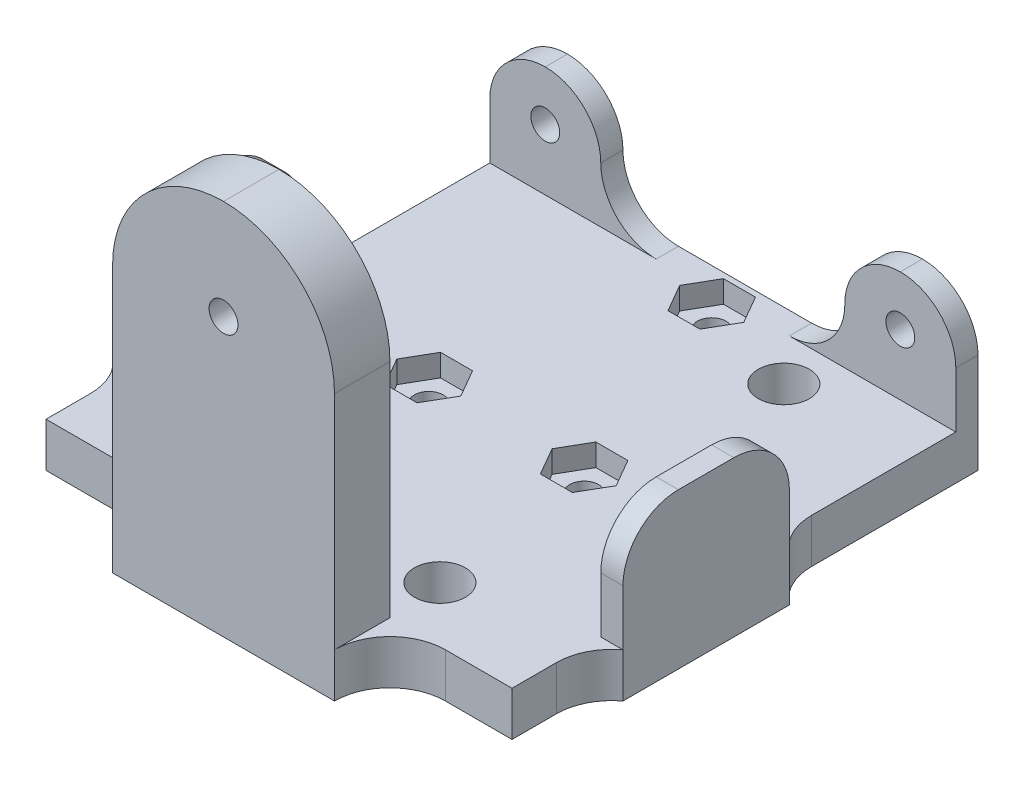
from build123d import *

# Parameters (mm, degrees)
EXTRUDE_1_DEPTH          = 4
SKETCH_2_W               = 2
SKETCH_2_H               = 15
SKETCH_2_W_2             = 10
SKETCH_2_H_2             = 2
EXTRUDE_2_DEPTH          = 10
SKETCH_3_W               = 20
SKETCH_3_H               = 5
EXTRUDE_3_DEPTH          = 30
SKETCH_4_R               = 1.3
CUT_EXTRUDE_1_DEPTH      = 2
SKETCH_5_R               = 1.3
CUT_EXTRUDE_2_DEPTH      = 59.72818744
CUT_EXTRUDE_3_DEPTH      = 3
SKETCH_7_R               = 1.3
SKETCH_7_R_2             = 2.3
CUT_EXTRUDE_5_DEPTH      = 45.511234537
CUT_EXTRUDE_6_DEPTH      = 2
CUT_EXTRUDE_6_DEPTH_BACK = 2
FILLET_1_R               = 10
FILLET_2_DEPTH           = 4
FILLET_START             = -23.5
FILLET_2_2_DEPTH         = 2
FILLET_START_2           = -24
FILLET_2_3_DEPTH         = 48
FILLET_2_4_DEPTH         = 2
FILLET_3_R               = 5


with BuildPart() as part:
    # 草图1 → 凸台-拉伸1 (new body)
    with BuildSketch(Plane(origin=(0, 0, 0), x_dir=(1, 0, 0), z_dir=(0, 1, 0))):
        Polygon((-21, 23.5), (-21, 4.5), (-23, 4.5), (-23, -10.5), (-21, -10.5), (-21, -18.5), (-11, -18.5), (-10, -18.5), (-10, -23.5), (10, -23.5), (10, -18.5), (11, -18.5), (21, -18.5), (21, -10.5), (23, -10.5), (23, 4.5), (21, 4.5), (21, 23.5), align=None)
    extrude(amount=EXTRUDE_1_DEPTH)

    # 草图2 → 凸台-拉伸2 (add)
    with BuildSketch(Plane(origin=(0, 4, 0), x_dir=(1, 0, 0), z_dir=(0, 1, 0))):
        with Locations((-22, -3)):
            Rectangle(SKETCH_2_W, SKETCH_2_H)
        with Locations((-16, 22.5)):
            Rectangle(SKETCH_2_W_2, SKETCH_2_H_2)
        with Locations((16, 22.5)):
            Rectangle(SKETCH_2_W_2, SKETCH_2_H_2)
        with Locations((22, -3)):
            Rectangle(SKETCH_2_W, SKETCH_2_H)
    extrude(amount=EXTRUDE_2_DEPTH)

    # 草图3 → 凸台-拉伸3 (add)
    with BuildSketch(Plane(origin=(0, 4, 0), x_dir=(1, 0, 0), z_dir=(0, 1, 0))):
        with Locations((0, -21)):
            Rectangle(SKETCH_3_W, SKETCH_3_H)
    extrude(amount=EXTRUDE_3_DEPTH)

    # 草图4 → 切除-拉伸1 (cut)
    with BuildSketch(Plane(origin=(0, 0, -23.5), x_dir=(-1, 0, 0), z_dir=(0, 0, -1))):
        with Locations((-16, 9.5)):
            Circle(SKETCH_4_R)
        with Locations((16, 9.5)):
            Circle(SKETCH_4_R)
    extrude(amount=-CUT_EXTRUDE_1_DEPTH, mode=Mode.SUBTRACT)

    # 草图5 → 切除-拉伸2 (cut, through all)
    with BuildSketch(Plane(origin=(0, 0, 18.5), x_dir=(-1, 0, 0), z_dir=(0, 0, -1))):
        with Locations((0, 25)):
            Circle(SKETCH_5_R)
    extrude(amount=-CUT_EXTRUDE_2_DEPTH, mode=Mode.SUBTRACT)

    # 草图6 → 切除-拉伸3 (cut)
    with BuildSketch(Plane(origin=(0, 0, 18.5), x_dir=(-1, 0, 0), z_dir=(0, 0, -1))):
        Polygon((2.886751346, 25), (1.443375673, 27.5), (-1.443375673, 27.5), (-2.886751346, 25), (-1.443375673, 22.5), (1.443375673, 22.5), align=None)
    extrude(amount=-CUT_EXTRUDE_3_DEPTH, mode=Mode.SUBTRACT)

    # 草图7 → 切除-拉伸5 (cut, through all)
    with BuildSketch(Plane(origin=(0, 4, 0), x_dir=(1, 0, 0), z_dir=(0, 1, 0))):
        with Locations(Location((0, 20.5, 0), (0, 0, 270))):
            Circle(SKETCH_7_R)
        with Locations(Location((-7, 2, 0), (0, 0, 270))):
            Circle(SKETCH_7_R)
        with Locations(Location((7, 2, 0), (0, 0, 270))):
            Circle(SKETCH_7_R)
        with Locations(Location((0, -16.5, 0), (0, 0, 270))):
            Circle(SKETCH_7_R)
        with Locations(Location((-18.5, 2, 0), (0, 0, 270))):
            Circle(SKETCH_7_R_2)
        with Locations(Location((9.5, 17.5, 0), (0, 0, 270))):
            Circle(SKETCH_7_R_2)
        with Locations(Location((9.5, -13.5, 0), (0, 0, 270))):
            Circle(SKETCH_7_R_2)
    extrude(amount=-CUT_EXTRUDE_5_DEPTH, mode=Mode.SUBTRACT)

    # 草图8 → 切除-拉伸6 (cut, two sides: drawn at the far end of the back side and taken through both)
    with BuildSketch(Plane(origin=(0, 4, 0), x_dir=(1, 0, 0), z_dir=(0, 1, 0)).offset(-CUT_EXTRUDE_6_DEPTH_BACK)):
        Polygon((9.886751346, 2), (8.443375673, 4.5), (5.556624327, 4.5), (4.113248654, 2), (5.556624327, -0.5), (8.443375673, -0.5), align=None)
        Polygon((-4.113248654, 2), (-5.556624327, 4.5), (-8.443375673, 4.5), (-9.886751346, 2), (-8.443375673, -0.5), (-5.556624327, -0.5), align=None)
        Polygon((2.886751346, 20.5), (1.443375673, 23), (-1.443375673, 23), (-2.886751346, 20.5), (-1.443375673, 18), (1.443375673, 18), align=None)
        Polygon((2.886751346, -16.5), (1.443375673, -14), (-1.443375673, -14), (-2.886751346, -16.5), (-1.443375673, -19), (1.443375673, -19), align=None)
    extrude(amount=CUT_EXTRUDE_6_DEPTH + CUT_EXTRUDE_6_DEPTH_BACK, mode=Mode.SUBTRACT)

    # 圆角1
    fillet_1_edges = [part.edges().sort_by_distance(p)[0] for p in [
        (-10, 34, 21),
        (10, 34, 21),
    ]]
    fillet(fillet_1_edges, radius=FILLET_1_R - 0.0001)  # a hair under: the kernel refuses the full size

    # 圆角2: read off the stored shape, not the designer's step
    # 圆角2 outline → 圆角2 (add)
    with BuildSketch(Plane(origin=(0, 0, 0), x_dir=(1, 0, 0), z_dir=(0, 1, 0))):
        with BuildLine():
            Line((-21, 4.5), (-21, 8.5))
            ThreePointArc((-21, 8.5), (-21.527864045, 6.263932023), (-23, 4.5))
            Line((-23, 4.5), (-21, 4.5))
        make_face()
        with BuildLine():
            ThreePointArc((21, -14.5), (21.527864045, -12.263932023), (23, -10.5))
            Line((23, -10.5), (21, -10.5))
            Line((21, -10.5), (21, -14.5))
        make_face()
        with BuildLine():
            Line((21, 4.5), (23, 4.5))
            ThreePointArc((23, 4.5), (21.527864045, 6.263932023), (21, 8.5))
            Line((21, 8.5), (21, 4.5))
        make_face()
        with BuildLine():
            Line((-21, -10.5), (-23, -10.5))
            ThreePointArc((-23, -10.5), (-21.527864045, -12.263932023), (-21, -14.5))
            Line((-21, -14.5), (-21, -10.5))
        make_face()
    extrude(amount=FILLET_2_DEPTH)

    # Fillet 2 2 outline → Fillet 2 2 (add)
    with BuildSketch(Plane.XY.offset(FILLET_START)):
        with BuildLine():
            Line((11, 4), (11, 9))
            ThreePointArc((11, 9), (9.535533906, 5.464466094), (6, 4))
            Line((6, 4), (11, 4))
        make_face()
        with BuildLine():
            Line((-11, 4), (-6, 4))
            ThreePointArc((-6, 4), (-9.535533906, 5.464466094), (-11, 9))
            Line((-11, 9), (-11, 4))
        make_face()
    extrude(amount=FILLET_2_2_DEPTH)

    # Fillet 2 3 outline → Fillet 2 3 (cut)
    with BuildSketch(Plane.YZ.offset(FILLET_START_2)):
        with BuildLine():
            Line((14, 10.5), (9, 10.5))
            ThreePointArc((9, 10.5), (12.535533906, 9.035533906), (14, 5.5))
            Line((14, 5.5), (14, 10.5))
        make_face()
        with BuildLine():
            Line((14, -4.5), (14, 0.5))
            ThreePointArc((14, 0.5), (12.535533906, -3.035533906), (9, -4.5))
            Line((9, -4.5), (14, -4.5))
        make_face()
    extrude(amount=FILLET_2_3_DEPTH, mode=Mode.SUBTRACT)

    # Fillet 2 4 outline → Fillet 2 4 (cut)
    with BuildSketch(Plane.XY.offset(FILLET_START)):
        with BuildLine():
            ThreePointArc((16, 14), (19.535533906, 12.535533906), (21, 9))
            Line((21, 9), (21, 14))
            Line((21, 14), (16, 14))
        make_face()
        with BuildLine():
            ThreePointArc((11, 9), (12.464466094, 12.535533906), (16, 14))
            Line((16, 14), (11, 14))
            Line((11, 14), (11, 9))
        make_face()
        with BuildLine():
            ThreePointArc((-16, 14), (-12.464466094, 12.535533906), (-11, 9))
            Line((-11, 9), (-11, 14))
            Line((-11, 14), (-16, 14))
        make_face()
        with BuildLine():
            Line((-21, 14), (-21, 9))
            ThreePointArc((-21, 9), (-19.535533906, 12.535533906), (-16, 14))
            Line((-16, 14), (-21, 14))
        make_face()
    extrude(amount=FILLET_2_4_DEPTH, mode=Mode.SUBTRACT)

    # 圆角3
    # the kernel refuses this fillet: 5 mm, written as the material it adds along each edge
    with BuildSketch(Plane(origin=(10, 0, 18.5), x_dir=(0, 0, 1), z_dir=(0, 1, 0))) as fillet_3_piece_1:
        with BuildLine():
            CenterArc((FILLET_3_R, FILLET_3_R), FILLET_3_R, 180, 90)
            Line((0, FILLET_3_R), (0, 0))
            Line((0, 0), (FILLET_3_R, 0))
        make_face()
    extrude(amount=4)
    with BuildSketch(Plane(origin=(-10, 0, 18.5), x_dir=(0, 0, 1), z_dir=(0, 1, 0))) as fillet_3_piece_2:
        with BuildLine():
            CenterArc((FILLET_3_R, -FILLET_3_R), FILLET_3_R, 90, 90)
            Line((0, -FILLET_3_R), (0, 0))
            Line((0, 0), (FILLET_3_R, 0))
        make_face()
    extrude(amount=4)


solid = part.part
